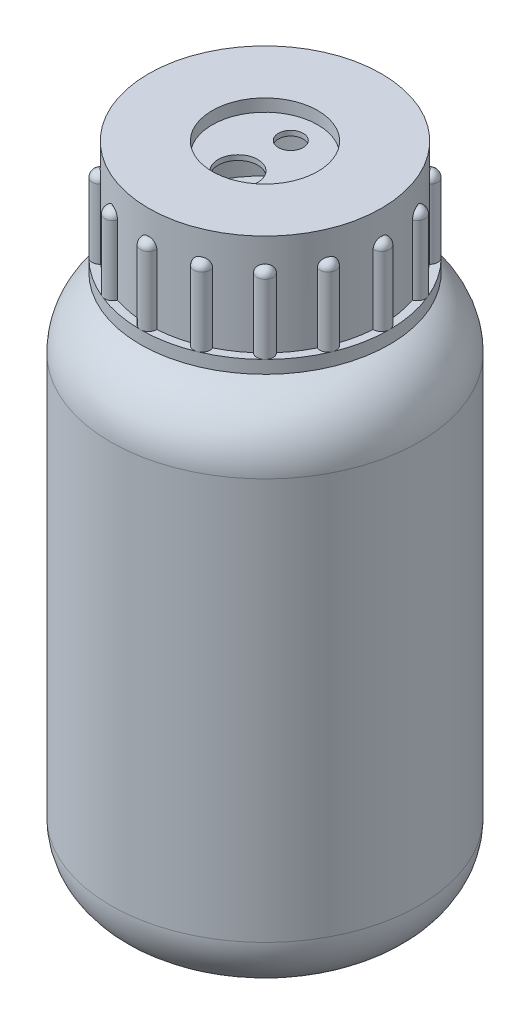
from build123d import *

# Parameters (mm, degrees)
SKETCH2_W                = 1.625
SKETCH2_H                = 2.6
EXTRUDE1_START           = 15.5
EXTRUDE1_DEPTH           = 15.5
FILLET1_R                = 1.5
CIRPATTERN1_COUNT        = 16
FILLET1_OF_CIRPATTERN1_R = 1.5
SKETCH4_R                = 4
SKETCH4_R_2              = 2.5
EXTRUDE2_DEPTH           = 15.5


with BuildPart() as part:
    # Sketch1 → Revolve-Thin1 (revolve)
    with BuildSketch(Plane.XY, mode=Mode.PRIVATE) as revolve_thin1_sk:
        with BuildLine():
            Line((0, 0), (-19.125, 0))
            ThreePointArc((-19.125, 0), (-27.610281374, 3.514718626), (-31.125, 12))
            Line((-31.125, 12), (-31.125, 92.969166765))
            ThreePointArc((-31.125, 92.969166765), (-28.317533317, 100.682618082), (-21.208778132, 104.786859802))
            Line((-21.208778132, 104.786859802), (-20, 105))
            Line((-20, 105), (-20, 107))
            Line((-20, 107), (-23.5, 107))
            Line((-23.5, 107), (-23.5, 130))
            Line((-23.5, 130), (-10.65, 130))
            Line((-10.65, 130), (-10.65, 127.5))
            Line((-10.65, 127.5), (0, 127.5))
            Line((0, 127.5), (0, 126.5))
            Line((0, 126.5), (-11.65, 126.5))
            Line((-11.65, 126.5), (-11.65, 129))
            Line((-11.65, 129), (-22.5, 129))
            Line((-22.5, 129), (-22.5, 108))
            Line((-22.5, 108), (-19, 108))
            Line((-19, 108), (-19, 104.160900369))
            Line((-19, 104.160900369), (-21.035129954, 103.802052049))
            ThreePointArc((-21.035129954, 103.802052049), (-27.551488874, 100.039830472), (-30.125, 92.969166765))
            Line((-30.125, 92.969166765), (-30.125, 12))
            ThreePointArc((-30.125, 12), (-26.903174593, 4.221825407), (-19.125, 1))
            Line((-19.125, 1), (0, 1))
            Line((0, 1), (0, 0))
        make_face()
    revolve(revolve_thin1_sk.sketch.rotate(Axis((0, 0, 0), (0, 1, 0)), 270), axis=Axis((0, 0, 0), (0, 1, 0)))

    # Sketch2 → Revolve1 (revolve)
    with BuildSketch(Plane(origin=(0, 0, 0), x_dir=(0, 0, -1), z_dir=(1, 0, 0))):
        with Locations((-24.3125, 108.3)):
            Rectangle(SKETCH2_W, SKETCH2_H)
    revolve(axis=Axis((0, 130, 0), (0, -1, 0)))

    # Sketch3 → Extrude1 (add)
    with BuildSketch(Plane(origin=(0, 109.6, 0), x_dir=(1, 0, 0), z_dir=(0, 1, 0)).offset(EXTRUDE1_START)):
        with BuildLine():
            ThreePointArc((1.624028452, 23.443816489), (0, 25.125), (-1.624028452, 23.443816489))
            ThreePointArc((-1.624028452, 23.443816489), (0, 23.5), (1.624028452, 23.443816489))
        make_face()
    extrude1 = extrude(amount=-EXTRUDE1_DEPTH)

    # Fillet1
    # the kernel refuses this fillet: 1.5 mm, written as the material it takes off along each edge
    with BuildSketch(Plane(origin=(0, 125.1, -23.5), x_dir=(0.0031415874858793033, 0, 0.9999950652018582), z_dir=(-0.9999950652018582, 0, 0.0031415874858793033))) as fillet1_piece_1_section:
        with BuildLine():
            CenterArc((1.625 - FILLET1_R, -FILLET1_R), FILLET1_R, 0, 90)
            Line((1.625 - FILLET1_R, 0), (1.625 - FILLET1_R, FILLET1_R * 0.02))
            Line((1.625 - FILLET1_R, FILLET1_R * 0.02), (1.625 + FILLET1_R * 0.02, FILLET1_R * 0.02))
            Line((1.625 + FILLET1_R * 0.02, FILLET1_R * 0.02), (1.625 + FILLET1_R * 0.02, -FILLET1_R))
            Line((1.625 + FILLET1_R * 0.02, -FILLET1_R), (1.625, -FILLET1_R))
        make_face()
    fillet1_piece_1 = revolve(axis=Axis((0, 125.1, -23.5), (0, 1, 0)), revolution_arc=359.64, mode=Mode.PRIVATE)
    fillet1_piece_1 = fillet1_piece_1 - Plane(origin=(0, 124.670074289, 0), x_dir=(0, 0, -1), z_dir=(0, 1, 0)) * Cylinder(23.5, 7, mode=Mode.PRIVATE)
    add(fillet1_piece_1, mode=Mode.SUBTRACT)

    # CirPattern1: Extrude1 ×16 about axis
    cirpattern1_axis = Axis((0, 0, 0), (0, 1, 0))
    for i in range(1, CIRPATTERN1_COUNT):
        add(extrude1.rotate(cirpattern1_axis, i * 360 / CIRPATTERN1_COUNT))

    # Fillet1 of CirPattern1
    # the kernel refuses this fillet: 1.5 mm, written as the material it takes off along each edge
    with BuildSketch(Plane(origin=(-8.993060661, 125.1, -21.711169014), x_dir=(0.3855839922773968, 0, 0.9226727398701147), z_dir=(-0.9226727398701147, 0, 0.3855839922773968))) as fillet1_of_cirpattern1_piece_1_section:
        with BuildLine():
            CenterArc((1.625 - FILLET1_OF_CIRPATTERN1_R, -FILLET1_OF_CIRPATTERN1_R), FILLET1_OF_CIRPATTERN1_R, 0, 90)
            Line((1.625 - FILLET1_OF_CIRPATTERN1_R, 0), (1.625 - FILLET1_OF_CIRPATTERN1_R, FILLET1_OF_CIRPATTERN1_R * 0.02))
            Line((1.625 - FILLET1_OF_CIRPATTERN1_R, FILLET1_OF_CIRPATTERN1_R * 0.02), (1.625 + FILLET1_OF_CIRPATTERN1_R * 0.02, FILLET1_OF_CIRPATTERN1_R * 0.02))
            Line((1.625 + FILLET1_OF_CIRPATTERN1_R * 0.02, FILLET1_OF_CIRPATTERN1_R * 0.02), (1.625 + FILLET1_OF_CIRPATTERN1_R * 0.02, -FILLET1_OF_CIRPATTERN1_R))
            Line((1.625 + FILLET1_OF_CIRPATTERN1_R * 0.02, -FILLET1_OF_CIRPATTERN1_R), (1.625, -FILLET1_OF_CIRPATTERN1_R))
        make_face()
    fillet1_of_cirpattern1_piece_1 = revolve(axis=Axis((-8.993060661, 125.1, -21.711169014), (0, 1, 0)), revolution_arc=359.64, mode=Mode.PRIVATE)
    fillet1_of_cirpattern1_piece_1 = fillet1_of_cirpattern1_piece_1 - Plane(origin=(0, 124.670074289, 0), x_dir=(0, 0, -1), z_dir=(0, 1, 0)) * Cylinder(23.5, 7, mode=Mode.PRIVATE)
    add(fillet1_of_cirpattern1_piece_1, mode=Mode.SUBTRACT)
    with BuildSketch(Plane(origin=(-16.617009358, 125.1, -16.617009358), x_dir=(0.7093247295722738, 0, 0.7048818539423617), z_dir=(-0.7048818539423617, 0, 0.7093247295722738))) as fillet1_of_cirpattern1_piece_2_section:
        with BuildLine():
            CenterArc((1.625 - FILLET1_OF_CIRPATTERN1_R, -FILLET1_OF_CIRPATTERN1_R), FILLET1_OF_CIRPATTERN1_R, 0, 90)
            Line((1.625 - FILLET1_OF_CIRPATTERN1_R, 0), (1.625 - FILLET1_OF_CIRPATTERN1_R, FILLET1_OF_CIRPATTERN1_R * 0.02))
            Line((1.625 - FILLET1_OF_CIRPATTERN1_R, FILLET1_OF_CIRPATTERN1_R * 0.02), (1.625 + FILLET1_OF_CIRPATTERN1_R * 0.02, FILLET1_OF_CIRPATTERN1_R * 0.02))
            Line((1.625 + FILLET1_OF_CIRPATTERN1_R * 0.02, FILLET1_OF_CIRPATTERN1_R * 0.02), (1.625 + FILLET1_OF_CIRPATTERN1_R * 0.02, -FILLET1_OF_CIRPATTERN1_R))
            Line((1.625 + FILLET1_OF_CIRPATTERN1_R * 0.02, -FILLET1_OF_CIRPATTERN1_R), (1.625, -FILLET1_OF_CIRPATTERN1_R))
        make_face()
    fillet1_of_cirpattern1_piece_2 = revolve(axis=Axis((-16.617009358, 125.1, -16.617009358), (0, 1, 0)), revolution_arc=359.64, mode=Mode.PRIVATE)
    fillet1_of_cirpattern1_piece_2 = fillet1_of_cirpattern1_piece_2 - Plane(origin=(0, 124.670074289, 0), x_dir=(0, 0, -1), z_dir=(0, 1, 0)) * Cylinder(23.5, 7, mode=Mode.PRIVATE)
    add(fillet1_of_cirpattern1_piece_2, mode=Mode.SUBTRACT)
    with BuildSketch(Plane(origin=(-21.711169014, 125.1, -8.993060661), x_dir=(0.9250772068344584, 0, 0.37977909552180056), z_dir=(-0.37977909552180056, 0, 0.9250772068344584))) as fillet1_of_cirpattern1_piece_3_section:
        with BuildLine():
            CenterArc((1.625 - FILLET1_OF_CIRPATTERN1_R, -FILLET1_OF_CIRPATTERN1_R), FILLET1_OF_CIRPATTERN1_R, 0, 90)
            Line((1.625 - FILLET1_OF_CIRPATTERN1_R, 0), (1.625 - FILLET1_OF_CIRPATTERN1_R, FILLET1_OF_CIRPATTERN1_R * 0.02))
            Line((1.625 - FILLET1_OF_CIRPATTERN1_R, FILLET1_OF_CIRPATTERN1_R * 0.02), (1.625 + FILLET1_OF_CIRPATTERN1_R * 0.02, FILLET1_OF_CIRPATTERN1_R * 0.02))
            Line((1.625 + FILLET1_OF_CIRPATTERN1_R * 0.02, FILLET1_OF_CIRPATTERN1_R * 0.02), (1.625 + FILLET1_OF_CIRPATTERN1_R * 0.02, -FILLET1_OF_CIRPATTERN1_R))
            Line((1.625 + FILLET1_OF_CIRPATTERN1_R * 0.02, -FILLET1_OF_CIRPATTERN1_R), (1.625, -FILLET1_OF_CIRPATTERN1_R))
        make_face()
    fillet1_of_cirpattern1_piece_3 = revolve(axis=Axis((-21.711169014, 125.1, -8.993060661), (0, 1, 0)), revolution_arc=359.64, mode=Mode.PRIVATE)
    fillet1_of_cirpattern1_piece_3 = fillet1_of_cirpattern1_piece_3 - Plane(origin=(0, 124.670074289, 0), x_dir=(0, 0, -1), z_dir=(0, 1, 0)) * Cylinder(23.5, 7, mode=Mode.PRIVATE)
    add(fillet1_of_cirpattern1_piece_3, mode=Mode.SUBTRACT)
    with BuildSketch(Plane(origin=(-23.5, 125.1, 0), x_dir=(0.9999950652018582, 0, -0.0031415874858791923), z_dir=(0.0031415874858791923, 0, 0.9999950652018582))) as fillet1_of_cirpattern1_piece_4_section:
        with BuildLine():
            CenterArc((1.625 - FILLET1_OF_CIRPATTERN1_R, -FILLET1_OF_CIRPATTERN1_R), FILLET1_OF_CIRPATTERN1_R, 0, 90)
            Line((1.625 - FILLET1_OF_CIRPATTERN1_R, 0), (1.625 - FILLET1_OF_CIRPATTERN1_R, FILLET1_OF_CIRPATTERN1_R * 0.02))
            Line((1.625 - FILLET1_OF_CIRPATTERN1_R, FILLET1_OF_CIRPATTERN1_R * 0.02), (1.625 + FILLET1_OF_CIRPATTERN1_R * 0.02, FILLET1_OF_CIRPATTERN1_R * 0.02))
            Line((1.625 + FILLET1_OF_CIRPATTERN1_R * 0.02, FILLET1_OF_CIRPATTERN1_R * 0.02), (1.625 + FILLET1_OF_CIRPATTERN1_R * 0.02, -FILLET1_OF_CIRPATTERN1_R))
            Line((1.625 + FILLET1_OF_CIRPATTERN1_R * 0.02, -FILLET1_OF_CIRPATTERN1_R), (1.625, -FILLET1_OF_CIRPATTERN1_R))
        make_face()
    fillet1_of_cirpattern1_piece_4 = revolve(axis=Axis((-23.5, 125.1, 0), (0, 1, 0)), revolution_arc=359.64, mode=Mode.PRIVATE)
    fillet1_of_cirpattern1_piece_4 = fillet1_of_cirpattern1_piece_4 - Plane(origin=(0, 124.670074289, 0), x_dir=(0, 0, -1), z_dir=(0, 1, 0)) * Cylinder(23.5, 7, mode=Mode.PRIVATE)
    add(fillet1_of_cirpattern1_piece_4, mode=Mode.SUBTRACT)
    with BuildSketch(Plane(origin=(-21.711169014, 125.1, 8.993060661), x_dir=(0.9226727398701152, 0, -0.385583992277396), z_dir=(0.385583992277396, 0, 0.9226727398701152))) as fillet1_of_cirpattern1_piece_5_section:
        with BuildLine():
            CenterArc((1.625 - FILLET1_OF_CIRPATTERN1_R, -FILLET1_OF_CIRPATTERN1_R), FILLET1_OF_CIRPATTERN1_R, 0, 90)
            Line((1.625 - FILLET1_OF_CIRPATTERN1_R, 0), (1.625 - FILLET1_OF_CIRPATTERN1_R, FILLET1_OF_CIRPATTERN1_R * 0.02))
            Line((1.625 - FILLET1_OF_CIRPATTERN1_R, FILLET1_OF_CIRPATTERN1_R * 0.02), (1.625 + FILLET1_OF_CIRPATTERN1_R * 0.02, FILLET1_OF_CIRPATTERN1_R * 0.02))
            Line((1.625 + FILLET1_OF_CIRPATTERN1_R * 0.02, FILLET1_OF_CIRPATTERN1_R * 0.02), (1.625 + FILLET1_OF_CIRPATTERN1_R * 0.02, -FILLET1_OF_CIRPATTERN1_R))
            Line((1.625 + FILLET1_OF_CIRPATTERN1_R * 0.02, -FILLET1_OF_CIRPATTERN1_R), (1.625, -FILLET1_OF_CIRPATTERN1_R))
        make_face()
    fillet1_of_cirpattern1_piece_5 = revolve(axis=Axis((-21.711169014, 125.1, 8.993060661), (0, 1, 0)), revolution_arc=359.64, mode=Mode.PRIVATE)
    fillet1_of_cirpattern1_piece_5 = fillet1_of_cirpattern1_piece_5 - Plane(origin=(0, 124.670074289, 0), x_dir=(0, 0, -1), z_dir=(0, 1, 0)) * Cylinder(23.5, 7, mode=Mode.PRIVATE)
    add(fillet1_of_cirpattern1_piece_5, mode=Mode.SUBTRACT)
    with BuildSketch(Plane(origin=(-16.617009358, 125.1, 16.617009358), x_dir=(0.7048818539423617, 0, -0.7093247295722738), z_dir=(0.7093247295722738, 0, 0.7048818539423617))) as fillet1_of_cirpattern1_piece_6_section:
        with BuildLine():
            CenterArc((1.625 - FILLET1_OF_CIRPATTERN1_R, -FILLET1_OF_CIRPATTERN1_R), FILLET1_OF_CIRPATTERN1_R, 0, 90)
            Line((1.625 - FILLET1_OF_CIRPATTERN1_R, 0), (1.625 - FILLET1_OF_CIRPATTERN1_R, FILLET1_OF_CIRPATTERN1_R * 0.02))
            Line((1.625 - FILLET1_OF_CIRPATTERN1_R, FILLET1_OF_CIRPATTERN1_R * 0.02), (1.625 + FILLET1_OF_CIRPATTERN1_R * 0.02, FILLET1_OF_CIRPATTERN1_R * 0.02))
            Line((1.625 + FILLET1_OF_CIRPATTERN1_R * 0.02, FILLET1_OF_CIRPATTERN1_R * 0.02), (1.625 + FILLET1_OF_CIRPATTERN1_R * 0.02, -FILLET1_OF_CIRPATTERN1_R))
            Line((1.625 + FILLET1_OF_CIRPATTERN1_R * 0.02, -FILLET1_OF_CIRPATTERN1_R), (1.625, -FILLET1_OF_CIRPATTERN1_R))
        make_face()
    fillet1_of_cirpattern1_piece_6 = revolve(axis=Axis((-16.617009358, 125.1, 16.617009358), (0, 1, 0)), revolution_arc=359.64, mode=Mode.PRIVATE)
    fillet1_of_cirpattern1_piece_6 = fillet1_of_cirpattern1_piece_6 - Plane(origin=(0, 124.670074289, 0), x_dir=(0, 0, -1), z_dir=(0, 1, 0)) * Cylinder(23.5, 7, mode=Mode.PRIVATE)
    add(fillet1_of_cirpattern1_piece_6, mode=Mode.SUBTRACT)
    with BuildSketch(Plane(origin=(-8.993060661, 125.1, 21.711169014), x_dir=(0.37977909552180145, 0, -0.9250772068344579), z_dir=(0.9250772068344579, 0, 0.37977909552180145))) as fillet1_of_cirpattern1_piece_7_section:
        with BuildLine():
            CenterArc((1.625 - FILLET1_OF_CIRPATTERN1_R, -FILLET1_OF_CIRPATTERN1_R), FILLET1_OF_CIRPATTERN1_R, 0, 90)
            Line((1.625 - FILLET1_OF_CIRPATTERN1_R, 0), (1.625 - FILLET1_OF_CIRPATTERN1_R, FILLET1_OF_CIRPATTERN1_R * 0.02))
            Line((1.625 - FILLET1_OF_CIRPATTERN1_R, FILLET1_OF_CIRPATTERN1_R * 0.02), (1.625 + FILLET1_OF_CIRPATTERN1_R * 0.02, FILLET1_OF_CIRPATTERN1_R * 0.02))
            Line((1.625 + FILLET1_OF_CIRPATTERN1_R * 0.02, FILLET1_OF_CIRPATTERN1_R * 0.02), (1.625 + FILLET1_OF_CIRPATTERN1_R * 0.02, -FILLET1_OF_CIRPATTERN1_R))
            Line((1.625 + FILLET1_OF_CIRPATTERN1_R * 0.02, -FILLET1_OF_CIRPATTERN1_R), (1.625, -FILLET1_OF_CIRPATTERN1_R))
        make_face()
    fillet1_of_cirpattern1_piece_7 = revolve(axis=Axis((-8.993060661, 125.1, 21.711169014), (0, 1, 0)), revolution_arc=359.64, mode=Mode.PRIVATE)
    fillet1_of_cirpattern1_piece_7 = fillet1_of_cirpattern1_piece_7 - Plane(origin=(0, 124.670074289, 0), x_dir=(0, 0, -1), z_dir=(0, 1, 0)) * Cylinder(23.5, 7, mode=Mode.PRIVATE)
    add(fillet1_of_cirpattern1_piece_7, mode=Mode.SUBTRACT)
    with BuildSketch(Plane(origin=(0, 125.1, 23.5), x_dir=(-0.003141587485879181, 0, -0.9999950652018582), z_dir=(0.9999950652018582, 0, -0.003141587485879181))) as fillet1_of_cirpattern1_piece_8_section:
        with BuildLine():
            CenterArc((1.625 - FILLET1_OF_CIRPATTERN1_R, -FILLET1_OF_CIRPATTERN1_R), FILLET1_OF_CIRPATTERN1_R, 0, 90)
            Line((1.625 - FILLET1_OF_CIRPATTERN1_R, 0), (1.625 - FILLET1_OF_CIRPATTERN1_R, FILLET1_OF_CIRPATTERN1_R * 0.02))
            Line((1.625 - FILLET1_OF_CIRPATTERN1_R, FILLET1_OF_CIRPATTERN1_R * 0.02), (1.625 + FILLET1_OF_CIRPATTERN1_R * 0.02, FILLET1_OF_CIRPATTERN1_R * 0.02))
            Line((1.625 + FILLET1_OF_CIRPATTERN1_R * 0.02, FILLET1_OF_CIRPATTERN1_R * 0.02), (1.625 + FILLET1_OF_CIRPATTERN1_R * 0.02, -FILLET1_OF_CIRPATTERN1_R))
            Line((1.625 + FILLET1_OF_CIRPATTERN1_R * 0.02, -FILLET1_OF_CIRPATTERN1_R), (1.625, -FILLET1_OF_CIRPATTERN1_R))
        make_face()
    fillet1_of_cirpattern1_piece_8 = revolve(axis=Axis((0, 125.1, 23.5), (0, 1, 0)), revolution_arc=359.64, mode=Mode.PRIVATE)
    fillet1_of_cirpattern1_piece_8 = fillet1_of_cirpattern1_piece_8 - Plane(origin=(0, 124.670074289, 0), x_dir=(0, 0, -1), z_dir=(0, 1, 0)) * Cylinder(23.5, 7, mode=Mode.PRIVATE)
    add(fillet1_of_cirpattern1_piece_8, mode=Mode.SUBTRACT)
    with BuildSketch(Plane(origin=(8.993060661, 125.1, 21.711169014), x_dir=(-0.3855839922773951, 0, -0.9226727398701153), z_dir=(0.9226727398701153, 0, -0.3855839922773951))) as fillet1_of_cirpattern1_piece_9_section:
        with BuildLine():
            CenterArc((1.625 - FILLET1_OF_CIRPATTERN1_R, -FILLET1_OF_CIRPATTERN1_R), FILLET1_OF_CIRPATTERN1_R, 0, 90)
            Line((1.625 - FILLET1_OF_CIRPATTERN1_R, 0), (1.625 - FILLET1_OF_CIRPATTERN1_R, FILLET1_OF_CIRPATTERN1_R * 0.02))
            Line((1.625 - FILLET1_OF_CIRPATTERN1_R, FILLET1_OF_CIRPATTERN1_R * 0.02), (1.625 + FILLET1_OF_CIRPATTERN1_R * 0.02, FILLET1_OF_CIRPATTERN1_R * 0.02))
            Line((1.625 + FILLET1_OF_CIRPATTERN1_R * 0.02, FILLET1_OF_CIRPATTERN1_R * 0.02), (1.625 + FILLET1_OF_CIRPATTERN1_R * 0.02, -FILLET1_OF_CIRPATTERN1_R))
            Line((1.625 + FILLET1_OF_CIRPATTERN1_R * 0.02, -FILLET1_OF_CIRPATTERN1_R), (1.625, -FILLET1_OF_CIRPATTERN1_R))
        make_face()
    fillet1_of_cirpattern1_piece_9 = revolve(axis=Axis((8.993060661, 125.1, 21.711169014), (0, 1, 0)), revolution_arc=359.64, mode=Mode.PRIVATE)
    fillet1_of_cirpattern1_piece_9 = fillet1_of_cirpattern1_piece_9 - Plane(origin=(0, 124.670074289, 0), x_dir=(0, 0, -1), z_dir=(0, 1, 0)) * Cylinder(23.5, 7, mode=Mode.PRIVATE)
    add(fillet1_of_cirpattern1_piece_9, mode=Mode.SUBTRACT)
    with BuildSketch(Plane(origin=(16.617009358, 125.1, 16.617009358), x_dir=(-0.7093247295722742, 0, -0.704881853942361), z_dir=(0.704881853942361, 0, -0.7093247295722742))) as fillet1_of_cirpattern1_piece_10_section:
        with BuildLine():
            CenterArc((1.625 - FILLET1_OF_CIRPATTERN1_R, -FILLET1_OF_CIRPATTERN1_R), FILLET1_OF_CIRPATTERN1_R, 0, 90)
            Line((1.625 - FILLET1_OF_CIRPATTERN1_R, 0), (1.625 - FILLET1_OF_CIRPATTERN1_R, FILLET1_OF_CIRPATTERN1_R * 0.02))
            Line((1.625 - FILLET1_OF_CIRPATTERN1_R, FILLET1_OF_CIRPATTERN1_R * 0.02), (1.625 + FILLET1_OF_CIRPATTERN1_R * 0.02, FILLET1_OF_CIRPATTERN1_R * 0.02))
            Line((1.625 + FILLET1_OF_CIRPATTERN1_R * 0.02, FILLET1_OF_CIRPATTERN1_R * 0.02), (1.625 + FILLET1_OF_CIRPATTERN1_R * 0.02, -FILLET1_OF_CIRPATTERN1_R))
            Line((1.625 + FILLET1_OF_CIRPATTERN1_R * 0.02, -FILLET1_OF_CIRPATTERN1_R), (1.625, -FILLET1_OF_CIRPATTERN1_R))
        make_face()
    fillet1_of_cirpattern1_piece_10 = revolve(axis=Axis((16.617009358, 125.1, 16.617009358), (0, 1, 0)), revolution_arc=359.64, mode=Mode.PRIVATE)
    fillet1_of_cirpattern1_piece_10 = fillet1_of_cirpattern1_piece_10 - Plane(origin=(0, 124.670074289, 0), x_dir=(0, 0, -1), z_dir=(0, 1, 0)) * Cylinder(23.5, 7, mode=Mode.PRIVATE)
    add(fillet1_of_cirpattern1_piece_10, mode=Mode.SUBTRACT)
    with BuildSketch(Plane(origin=(21.711169014, 125.1, 8.993060661), x_dir=(-0.9250772068344583, 0, -0.3797790955218007), z_dir=(0.3797790955218007, 0, -0.9250772068344583))) as fillet1_of_cirpattern1_piece_11_section:
        with BuildLine():
            CenterArc((1.625 - FILLET1_OF_CIRPATTERN1_R, -FILLET1_OF_CIRPATTERN1_R), FILLET1_OF_CIRPATTERN1_R, 0, 90)
            Line((1.625 - FILLET1_OF_CIRPATTERN1_R, 0), (1.625 - FILLET1_OF_CIRPATTERN1_R, FILLET1_OF_CIRPATTERN1_R * 0.02))
            Line((1.625 - FILLET1_OF_CIRPATTERN1_R, FILLET1_OF_CIRPATTERN1_R * 0.02), (1.625 + FILLET1_OF_CIRPATTERN1_R * 0.02, FILLET1_OF_CIRPATTERN1_R * 0.02))
            Line((1.625 + FILLET1_OF_CIRPATTERN1_R * 0.02, FILLET1_OF_CIRPATTERN1_R * 0.02), (1.625 + FILLET1_OF_CIRPATTERN1_R * 0.02, -FILLET1_OF_CIRPATTERN1_R))
            Line((1.625 + FILLET1_OF_CIRPATTERN1_R * 0.02, -FILLET1_OF_CIRPATTERN1_R), (1.625, -FILLET1_OF_CIRPATTERN1_R))
        make_face()
    fillet1_of_cirpattern1_piece_11 = revolve(axis=Axis((21.711169014, 125.1, 8.993060661), (0, 1, 0)), revolution_arc=359.64, mode=Mode.PRIVATE)
    fillet1_of_cirpattern1_piece_11 = fillet1_of_cirpattern1_piece_11 - Plane(origin=(0, 124.670074289, 0), x_dir=(0, 0, -1), z_dir=(0, 1, 0)) * Cylinder(23.5, 7, mode=Mode.PRIVATE)
    add(fillet1_of_cirpattern1_piece_11, mode=Mode.SUBTRACT)
    with BuildSketch(Plane(origin=(23.5, 125.1, 0), x_dir=(-0.9999950652018582, 0, 0.0031415874858790813), z_dir=(-0.0031415874858790813, 0, -0.9999950652018582))) as fillet1_of_cirpattern1_piece_12_section:
        with BuildLine():
            CenterArc((1.625 - FILLET1_OF_CIRPATTERN1_R, -FILLET1_OF_CIRPATTERN1_R), FILLET1_OF_CIRPATTERN1_R, 0, 90)
            Line((1.625 - FILLET1_OF_CIRPATTERN1_R, 0), (1.625 - FILLET1_OF_CIRPATTERN1_R, FILLET1_OF_CIRPATTERN1_R * 0.02))
            Line((1.625 - FILLET1_OF_CIRPATTERN1_R, FILLET1_OF_CIRPATTERN1_R * 0.02), (1.625 + FILLET1_OF_CIRPATTERN1_R * 0.02, FILLET1_OF_CIRPATTERN1_R * 0.02))
            Line((1.625 + FILLET1_OF_CIRPATTERN1_R * 0.02, FILLET1_OF_CIRPATTERN1_R * 0.02), (1.625 + FILLET1_OF_CIRPATTERN1_R * 0.02, -FILLET1_OF_CIRPATTERN1_R))
            Line((1.625 + FILLET1_OF_CIRPATTERN1_R * 0.02, -FILLET1_OF_CIRPATTERN1_R), (1.625, -FILLET1_OF_CIRPATTERN1_R))
        make_face()
    fillet1_of_cirpattern1_piece_12 = revolve(axis=Axis((23.5, 125.1, 0), (0, 1, 0)), revolution_arc=359.64, mode=Mode.PRIVATE)
    fillet1_of_cirpattern1_piece_12 = fillet1_of_cirpattern1_piece_12 - Plane(origin=(0, 124.670074289, 0), x_dir=(0, 0, -1), z_dir=(0, 1, 0)) * Cylinder(23.5, 7, mode=Mode.PRIVATE)
    add(fillet1_of_cirpattern1_piece_12, mode=Mode.SUBTRACT)
    with BuildSketch(Plane(origin=(21.711169014, 125.1, -8.993060661), x_dir=(-0.9226727398701148, 0, 0.38558399227739704), z_dir=(-0.38558399227739704, 0, -0.9226727398701148))) as fillet1_of_cirpattern1_piece_13_section:
        with BuildLine():
            CenterArc((1.625 - FILLET1_OF_CIRPATTERN1_R, -FILLET1_OF_CIRPATTERN1_R), FILLET1_OF_CIRPATTERN1_R, 0, 90)
            Line((1.625 - FILLET1_OF_CIRPATTERN1_R, 0), (1.625 - FILLET1_OF_CIRPATTERN1_R, FILLET1_OF_CIRPATTERN1_R * 0.02))
            Line((1.625 - FILLET1_OF_CIRPATTERN1_R, FILLET1_OF_CIRPATTERN1_R * 0.02), (1.625 + FILLET1_OF_CIRPATTERN1_R * 0.02, FILLET1_OF_CIRPATTERN1_R * 0.02))
            Line((1.625 + FILLET1_OF_CIRPATTERN1_R * 0.02, FILLET1_OF_CIRPATTERN1_R * 0.02), (1.625 + FILLET1_OF_CIRPATTERN1_R * 0.02, -FILLET1_OF_CIRPATTERN1_R))
            Line((1.625 + FILLET1_OF_CIRPATTERN1_R * 0.02, -FILLET1_OF_CIRPATTERN1_R), (1.625, -FILLET1_OF_CIRPATTERN1_R))
        make_face()
    fillet1_of_cirpattern1_piece_13 = revolve(axis=Axis((21.711169014, 125.1, -8.993060661), (0, 1, 0)), revolution_arc=359.64, mode=Mode.PRIVATE)
    fillet1_of_cirpattern1_piece_13 = fillet1_of_cirpattern1_piece_13 - Plane(origin=(0, 124.670074289, 0), x_dir=(0, 0, -1), z_dir=(0, 1, 0)) * Cylinder(23.5, 7, mode=Mode.PRIVATE)
    add(fillet1_of_cirpattern1_piece_13, mode=Mode.SUBTRACT)
    with BuildSketch(Plane(origin=(16.617009358, 125.1, -16.617009358), x_dir=(-0.7048818539423616, 0, 0.7093247295722737), z_dir=(-0.7093247295722737, 0, -0.7048818539423616))) as fillet1_of_cirpattern1_piece_14_section:
        with BuildLine():
            CenterArc((1.625 - FILLET1_OF_CIRPATTERN1_R, -FILLET1_OF_CIRPATTERN1_R), FILLET1_OF_CIRPATTERN1_R, 0, 90)
            Line((1.625 - FILLET1_OF_CIRPATTERN1_R, 0), (1.625 - FILLET1_OF_CIRPATTERN1_R, FILLET1_OF_CIRPATTERN1_R * 0.02))
            Line((1.625 - FILLET1_OF_CIRPATTERN1_R, FILLET1_OF_CIRPATTERN1_R * 0.02), (1.625 + FILLET1_OF_CIRPATTERN1_R * 0.02, FILLET1_OF_CIRPATTERN1_R * 0.02))
            Line((1.625 + FILLET1_OF_CIRPATTERN1_R * 0.02, FILLET1_OF_CIRPATTERN1_R * 0.02), (1.625 + FILLET1_OF_CIRPATTERN1_R * 0.02, -FILLET1_OF_CIRPATTERN1_R))
            Line((1.625 + FILLET1_OF_CIRPATTERN1_R * 0.02, -FILLET1_OF_CIRPATTERN1_R), (1.625, -FILLET1_OF_CIRPATTERN1_R))
        make_face()
    fillet1_of_cirpattern1_piece_14 = revolve(axis=Axis((16.617009358, 125.1, -16.617009358), (0, 1, 0)), revolution_arc=359.64, mode=Mode.PRIVATE)
    fillet1_of_cirpattern1_piece_14 = fillet1_of_cirpattern1_piece_14 - Plane(origin=(0, 124.670074289, 0), x_dir=(0, 0, -1), z_dir=(0, 1, 0)) * Cylinder(23.5, 7, mode=Mode.PRIVATE)
    add(fillet1_of_cirpattern1_piece_14, mode=Mode.SUBTRACT)
    with BuildSketch(Plane(origin=(8.993060661, 125.1, -21.711169014), x_dir=(-0.37977909552180067, 0, 0.9250772068344582), z_dir=(-0.9250772068344582, 0, -0.37977909552180067))) as fillet1_of_cirpattern1_piece_15_section:
        with BuildLine():
            CenterArc((1.625 - FILLET1_OF_CIRPATTERN1_R, -FILLET1_OF_CIRPATTERN1_R), FILLET1_OF_CIRPATTERN1_R, 0, 90)
            Line((1.625 - FILLET1_OF_CIRPATTERN1_R, 0), (1.625 - FILLET1_OF_CIRPATTERN1_R, FILLET1_OF_CIRPATTERN1_R * 0.02))
            Line((1.625 - FILLET1_OF_CIRPATTERN1_R, FILLET1_OF_CIRPATTERN1_R * 0.02), (1.625 + FILLET1_OF_CIRPATTERN1_R * 0.02, FILLET1_OF_CIRPATTERN1_R * 0.02))
            Line((1.625 + FILLET1_OF_CIRPATTERN1_R * 0.02, FILLET1_OF_CIRPATTERN1_R * 0.02), (1.625 + FILLET1_OF_CIRPATTERN1_R * 0.02, -FILLET1_OF_CIRPATTERN1_R))
            Line((1.625 + FILLET1_OF_CIRPATTERN1_R * 0.02, -FILLET1_OF_CIRPATTERN1_R), (1.625, -FILLET1_OF_CIRPATTERN1_R))
        make_face()
    fillet1_of_cirpattern1_piece_15 = revolve(axis=Axis((8.993060661, 125.1, -21.711169014), (0, 1, 0)), revolution_arc=359.64, mode=Mode.PRIVATE)
    fillet1_of_cirpattern1_piece_15 = fillet1_of_cirpattern1_piece_15 - Plane(origin=(0, 124.670074289, 0), x_dir=(0, 0, -1), z_dir=(0, 1, 0)) * Cylinder(23.5, 7, mode=Mode.PRIVATE)
    add(fillet1_of_cirpattern1_piece_15, mode=Mode.SUBTRACT)

    # Sketch4 → Extrude2 (cut)
    with BuildSketch(Plane(origin=(0, 127.5, 0), x_dir=(1, 0, 0), z_dir=(0, 1, 0))):
        with Locations(Location((0, -5.451730267, 0), (0, 0, 270))):
            Circle(SKETCH4_R)
        with Locations(Location((0, 5.198161418, 0), (0, 0, 270))):
            Circle(SKETCH4_R_2)
    extrude(amount=-EXTRUDE2_DEPTH, mode=Mode.SUBTRACT)


solid = part.part
